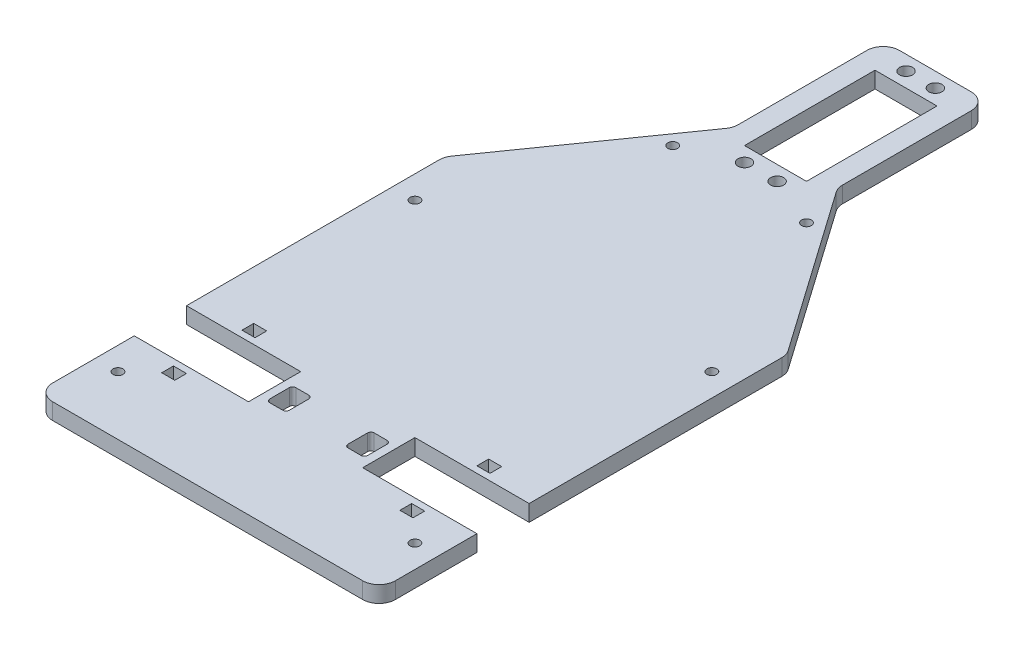
from build123d import *

# Parameters (mm, degrees)
BOSS_EXTRUDE1_DEPTH = 5
SKETCH2_R           = 2
SKETCH2_R_2         = 1.5
SKETCH2_W           = 19
SKETCH2_H           = 40
SKETCH2_W_2         = 3.995778709
SKETCH2_H_2         = 3.597560242
SKETCH2_W_3         = 35
SKETCH2_H_3         = 16
SKETCH2_W_4         = 6
SKETCH2_H_4         = 8
SKETCH2_H_5         = 3.6
SKETCH2_W_5         = 4
CUT_EXTRUDE1_DEPTH  = 7
FILLET1_R           = 5
FILLET2_R           = 5
FILLET3_R           = 5
FILLET4_R           = 5
FILLET5_R           = 5
FILLET6_R           = 5
FILLET8_R           = 1
FILLET9_R           = 1
FILLET10_R          = 5


with BuildPart() as part:
    # Sketch1 → Boss-Extrude1 (new body)
    with BuildSketch(Plane(origin=(0, 0, 0), x_dir=(1, 0, 0), z_dir=(0, 1, 0))):
        Polygon((-16, 108), (16, 108), (16, 62), (52.5, 10), (52.5, -115), (-52.5, -115), (-52.5, 10), (-16, 62), align=None)
    extrude(amount=BOSS_EXTRUDE1_DEPTH)

    # Sketch2 → Cut-Extrude1 (cut)
    with BuildSketch(Plane(origin=(0, 5, 0), x_dir=(1, 0, 0), z_dir=(0, 1, 0))):
        with Locations((-4.5, 103.5)):
            Circle(SKETCH2_R)
        with Locations((4.5, 103.5)):
            Circle(SKETCH2_R)
        with Locations((-5, 54.502551087)):
            Circle(SKETCH2_R)
        with Locations((5, 54.502551087)):
            Circle(SKETCH2_R)
        with Locations((-20.5, 48)):
            Circle(SKETCH2_R_2)
        with Locations((20.5, 48)):
            Circle(SKETCH2_R_2)
        with Locations((45.5, -6)):
            Circle(SKETCH2_R_2)
        with Locations((-45.5, -6)):
            Circle(SKETCH2_R_2)
        with Locations((45.5, -97)):
            Circle(SKETCH2_R_2)
        with Locations((-45.5, -97)):
            Circle(SKETCH2_R_2)
        with Locations((0, 79)):
            Rectangle(SKETCH2_W, SKETCH2_H)
        with Locations((-35.502110645, -65.201219879)):
            Rectangle(SKETCH2_W_2, SKETCH2_H_2)
        with Locations((-35, -77)):
            Rectangle(SKETCH2_W_3, SKETCH2_H_3)
        with Locations((35, -77)):
            Rectangle(SKETCH2_W_3, SKETCH2_H_3)
        with Locations((-12, -78)):
            Rectangle(SKETCH2_W_4, SKETCH2_H_4)
        with Locations((12, -78)):
            Rectangle(SKETCH2_W_4, SKETCH2_H_4)
        with Locations((-36.502110645, -88.8)):
            Rectangle(SKETCH2_W_2, SKETCH2_H_5)
        with Locations((36.5, -88.8)):
            Rectangle(SKETCH2_W_5, SKETCH2_H_5)
        with Locations((36.5, -65.2)):
            Rectangle(SKETCH2_W_5, SKETCH2_H_5)
    extrude(amount=-CUT_EXTRUDE1_DEPTH, mode=Mode.SUBTRACT)

    # Fillet1
    fillet1_edges = [part.edges().sort_by_distance(p)[0] for p in [
        (16, 2.5, -108),
    ]]
    fillet(fillet1_edges, radius=FILLET1_R)

    # Fillet2
    fillet2_edges = [part.edges().sort_by_distance(p)[0] for p in [
        (-16, 2.5, -108),
    ]]
    fillet(fillet2_edges, radius=FILLET2_R)

    # Fillet3
    fillet3_edges = [part.edges().sort_by_distance(p)[0] for p in [
        (52.5, 2.5, -10),
    ]]
    fillet(fillet3_edges, radius=FILLET3_R)

    # Fillet4
    fillet4_edges = [part.edges().sort_by_distance(p)[0] for p in [
        (-52.5, 2.5, -10),
    ]]
    fillet(fillet4_edges, radius=FILLET4_R)

    # Fillet5
    fillet5_edges = [part.edges().sort_by_distance(p)[0] for p in [
        (52.5, 2.5, 115),
    ]]
    fillet(fillet5_edges, radius=FILLET5_R)

    # Fillet6
    fillet6_edges = [part.edges().sort_by_distance(p)[0] for p in [
        (-52.5, 2.5, 115),
    ]]
    fillet(fillet6_edges, radius=FILLET6_R)

    # Fillet8
    fillet8_edges = [part.edges().sort_by_distance(p)[0] for p in [
        (15, 2.5, 74),
    ]]
    fillet(fillet8_edges, radius=FILLET8_R)

    # Fillet9
    fillet9_edges = [part.edges().sort_by_distance(p)[0] for p in [
        (-15, 2.5, 82),
        (-15, 2.5, 74),
        (-9, 2.5, 82),
        (-9, 2.5, 74),
        (9, 2.5, 82),
        (15, 2.5, 82),
        (9, 2.5, 74),
    ]]
    fillet(fillet9_edges, radius=FILLET9_R)

    # Fillet10
    fillet10_edges = [part.edges().sort_by_distance(p)[0] for p in [
        (-16, 2.5, -62),
        (16, 2.5, -62),
    ]]
    fillet(fillet10_edges, radius=FILLET10_R)


solid = part.part
